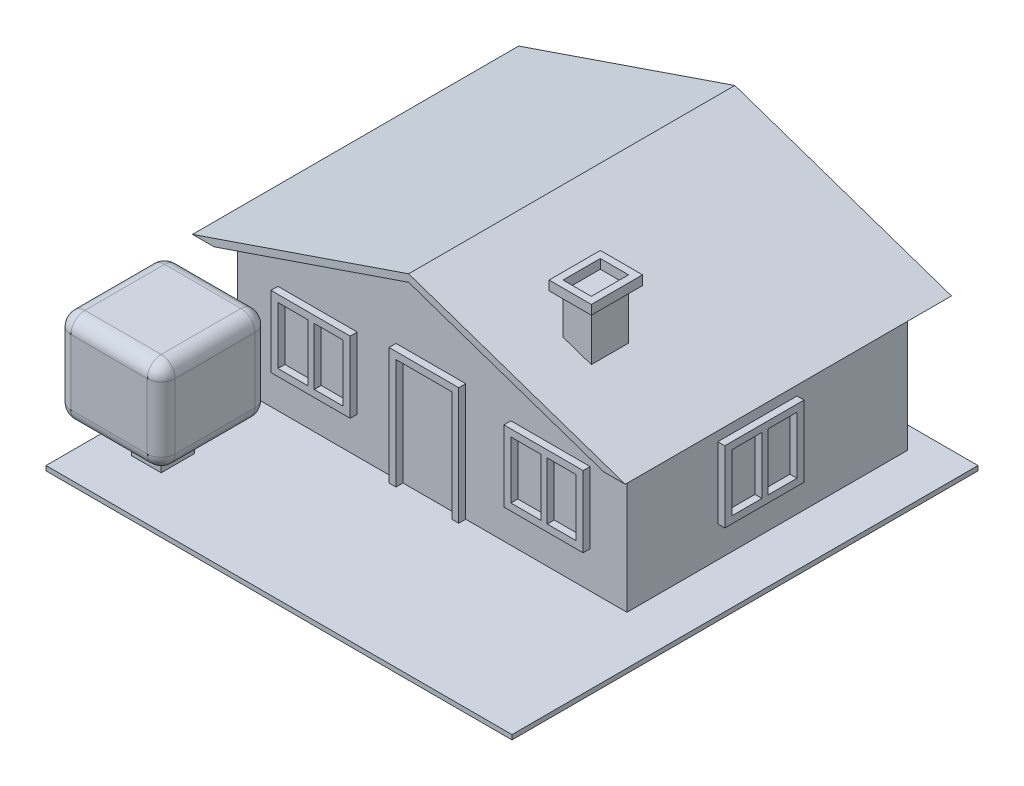
from build123d import *

# Parameters (mm, degrees)
ESBO_O1_W                     = 1
ESBO_O1_H                     = 1
RESSALTO_EXTRUS_O1_DEPTH      = 0.01
ESBO_O2_W                     = 0.835884883
ESBO_O2_H                     = 0.601923969
RESSALTO_EXTRUS_O3_DEPTH      = 0.3
RESSALTO_EXTRUS_O5_DEPTH      = 0.2
RESSALTO_EXTRUS_O5_DEPTH_BACK = 0.5
CORTE_EXTRUS_O2_DEPTH         = 0.050581546
CORTE_EXTRUS_O5_DEPTH         = 0.047494485
ESBO_O8_W                     = 0.17
ESBO_O8_H                     = 0.1527975
ESBO_O8_W_2                   = 0.064789378
ESBO_O8_H_2                   = 0.1227975
ESBO_O8_W_3                   = 0.0620701
RESSALTO_EXTRUS_O7_DEPTH      = 0.015
ESBO_O7_W                     = 0.17
ESBO_O7_H                     = 0.1527975
ESBO_O7_W_2                   = 0.064789378
ESBO_O7_H_2                   = 0.1227975
ESBO_O7_W_3                   = 0.0620701
RESSALTO_EXTRUS_O8_DEPTH      = 0.015
ESBO_O6_W                     = 0.17
ESBO_O6_H                     = 0.152797499
ESBO_O6_W_2                   = 0.0620701
ESBO_O6_H_2                   = 0.122797499
ESBO_O6_W_3                   = 0.064789378
RESSALTO_EXTRUS_O9_DEPTH      = 0.015
ESBO_O9_W                     = 0.063807516
ESBO_O9_H                     = 0.071007721
RESSALTO_EXTRUS_O10_DEPTH     = 0.07
ESBO_O11_W                    = 0.223807516
ESBO_O11_H                    = 0.231007721
RESSALTO_EXTRUS_O11_DEPTH     = 0.2
FILETE2_R                     = 0.03
FILETE3_R                     = 0.03
RESSALTO_EXTRUS_O12_DEPTH     = 0.08
ESBO_O13_W                    = 0.090661603
ESBO_O13_H                    = 0.11
ESBO_O13_W_2                  = 0.060661603
ESBO_O13_H_2                  = 0.08
RESSALTO_EXTRUS_O13_DEPTH     = 0.02


with BuildPart() as part:
    # Esboço1 → Ressalto-extrusão1 (new body)
    with BuildSketch(Plane(origin=(0, 0, 0), x_dir=(1, 0, 0), z_dir=(0, 1, 0))):
        Rectangle(ESBO_O1_W, ESBO_O1_H)
    extrude(amount=RESSALTO_EXTRUS_O1_DEPTH)

    # Esboço2 → Ressalto-extrusão3 (add)
    with BuildSketch(Plane(origin=(0, 0.01, 0), x_dir=(1, 0, 0), z_dir=(0, 1, 0))):
        with Locations((-0.021781552, 0.151543531)):
            Rectangle(ESBO_O2_W, ESBO_O2_H)
    extrude(amount=RESSALTO_EXTRUS_O3_DEPTH)

    # Esboço3 → Ressalto-extrusão5 (add, two sides: drawn at the far end of the back side and taken through both)
    with BuildSketch(Plane.XY.offset(-RESSALTO_EXTRUS_O5_DEPTH_BACK)):
        Polygon((-0.021781553, 0.455456142), (-0.485697767, 0.296752266), (0.443092699, 0.296752266), align=None)
    extrude(amount=RESSALTO_EXTRUS_O5_DEPTH + RESSALTO_EXTRUS_O5_DEPTH_BACK)

    # Esboço4 → Corte-extrusão2 (cut)
    with BuildSketch(Plane.XY.offset(0.2)):
        Polygon((-0.439355675, 0.296752266), (0.396664924, 0.296752266), (-0.021776549, 0.43960441), align=None)
    extrude(amount=-CORTE_EXTRUS_O2_DEPTH, mode=Mode.SUBTRACT)

    # Esboço5 → Corte-extrusão5 (cut)
    with BuildSketch(Plane(origin=(0, 0, -0.5), x_dir=(-1, 0, 0), z_dir=(0, 0, -1))):
        Polygon((0.471154082, 0.285874159), (-0.423424888, 0.287616656), (0.021776549, 0.43960441), align=None)
    extrude(amount=-CORTE_EXTRUS_O5_DEPTH, mode=Mode.SUBTRACT)

    # Esboço8 → Ressalto-extrusão7 (add)
    with BuildSketch(Plane(origin=(0.396160889, 0, 0), x_dir=(0, 0, -1), z_dir=(1, 0, 0))):
        with Locations((0.130456206, 0.153176171)):
            Rectangle(ESBO_O8_W, ESBO_O8_H)
        with Locations((0.092850895, 0.153176171)):
            Rectangle(ESBO_O8_W_2, ESBO_O8_H_2, mode=Mode.SUBTRACT)
        with Locations((0.169421156, 0.153176171)):
            Rectangle(ESBO_O8_W_3, ESBO_O8_H_2, mode=Mode.SUBTRACT)
    extrude(amount=RESSALTO_EXTRUS_O7_DEPTH)

    # Esboço7 → Ressalto-extrusão8 (add)
    with BuildSketch(Plane.ZY.offset(0.439723994)):
        with Locations((-0.158153325, 0.157477131)):
            Rectangle(ESBO_O7_W, ESBO_O7_H)
        with Locations((-0.195758636, 0.157477131)):
            Rectangle(ESBO_O7_W_2, ESBO_O7_H_2, mode=Mode.SUBTRACT)
        with Locations((-0.119188375, 0.157477131)):
            Rectangle(ESBO_O7_W_3, ESBO_O7_H_2, mode=Mode.SUBTRACT)
    extrude(amount=RESSALTO_EXTRUS_O8_DEPTH)

    # Esboço6 → Ressalto-extrusão9 (add)
    # profile 1 of 3: a face of its own
    with BuildSketch(Plane.XY.offset(0.149418454)):
        Polygon((-0.099530915, 0.01), (-0.084530915, 0.01), (-0.084530915, 0.246938695), (0.035135203, 0.246938695), (0.035135203, 0.01), (0.050135203, 0.01), (0.050135203, 0.261938695), (-0.099530915, 0.261938695), align=None)
    # profile 2 of 3: a face of its own
    with BuildSketch(Plane.XY.offset(0.149418454)):
        with Locations((-0.267908896, 0.164969523)):
            Rectangle(ESBO_O6_W, ESBO_O6_H)
        with Locations((-0.228943946, 0.164969523)):
            Rectangle(ESBO_O6_W_2, ESBO_O6_H_2, mode=Mode.SUBTRACT)
        with Locations((-0.305514207, 0.164969523)):
            Rectangle(ESBO_O6_W_3, ESBO_O6_H_2, mode=Mode.SUBTRACT)
    # profile 3 of 3: a face of its own
    with BuildSketch(Plane.XY.offset(0.149418454)):
        with Locations((0.232091104, 0.164969523)):
            Rectangle(ESBO_O6_W, ESBO_O6_H)
        with Locations((0.271056054, 0.164969523)):
            Rectangle(ESBO_O6_W_2, ESBO_O6_H_2, mode=Mode.SUBTRACT)
        with Locations((0.194485793, 0.164969523)):
            Rectangle(ESBO_O6_W_3, ESBO_O6_H_2, mode=Mode.SUBTRACT)
    extrude(amount=RESSALTO_EXTRUS_O9_DEPTH)

    # Esboço9 → Ressalto-extrusão10 (add)
    with BuildSketch(Plane(origin=(0, 0.01, 0), x_dir=(1, 0, 0), z_dir=(0, 1, 0))):
        with Locations((-0.394760136, -0.354413696)):
            Rectangle(ESBO_O9_W, ESBO_O9_H)
    extrude(amount=RESSALTO_EXTRUS_O10_DEPTH)

    # Esboço11 → Ressalto-extrusão11 (add)
    with BuildSketch(Plane(origin=(0, 0.08, 0), x_dir=(1, 0, 0), z_dir=(0, 1, 0))):
        with Locations((-0.394760136, -0.354413696)):
            Rectangle(ESBO_O11_W, ESBO_O11_H)
    extrude(amount=RESSALTO_EXTRUS_O11_DEPTH)

    # Filete2
    filete2_edges = [part.edges().sort_by_distance(p)[0] for p in [
        (-0.506663894, 0.08, 0.354413695),
        (-0.506663894, 0.18, 0.238909835),
        (-0.394760136, 0.08, 0.469917556),
        (-0.506663894, 0.18, 0.469917556),
        (-0.282856378, 0.18, 0.469917556),
        (-0.394760136, 0.28, 0.238909835),
        (-0.506663894, 0.28, 0.354413695),
        (-0.394760136, 0.28, 0.469917556),
        (-0.282856378, 0.28, 0.354413695),
    ]]
    fillet(filete2_edges, radius=FILETE2_R)

    # Filete3
    # the kernel refuses this fillet: 0.03 mm, written as the material it takes off along each edge
    with BuildSketch(Plane(origin=(-0.476663894, 0.11, 0.268909835), x_dir=(0, 0, -1), z_dir=(0, -1, 0))) as filete3_piece_1_section:
        Polygon((0, 0), (FILETE3_R, 0), (FILETE3_R, -FILETE3_R), (0, -FILETE3_R), align=None)
    filete3_piece_1 = extrude(amount=FILETE3_R, mode=Mode.PRIVATE)
    filete3_piece_1 = filete3_piece_1 - Plane(origin=(-0.476663894, 0.11, 0.268909835), x_dir=(0.7071067811865475, 0, 0.7071067811865475), z_dir=(0, -1, 0)) * Sphere(FILETE3_R, mode=Mode.PRIVATE)
    add(filete3_piece_1, mode=Mode.SUBTRACT)
    with BuildSketch(Plane(origin=(-0.312856378, 0.25, 0.268909835), x_dir=(1, 0, 0), z_dir=(0, 0, -1))) as filete3_piece_2_section:
        Polygon((0, 0), (FILETE3_R, 0), (FILETE3_R, -FILETE3_R), (0, -FILETE3_R), align=None)
    filete3_piece_2 = extrude(amount=FILETE3_R, mode=Mode.PRIVATE)
    filete3_piece_2 = filete3_piece_2 - Plane(origin=(-0.312856378, 0.25, 0.268909835), x_dir=(-0.7071067811865475, -0.7071067811865475, 0), z_dir=(0, 0, -1)) * Sphere(FILETE3_R, mode=Mode.PRIVATE)
    add(filete3_piece_2, mode=Mode.SUBTRACT)
    with BuildSketch(Plane(origin=(-0.312856378, 0.11, 0.439917556), x_dir=(1, 0, 0), z_dir=(0, -1, 0))) as filete3_piece_3_section:
        Polygon((0, 0), (FILETE3_R, 0), (FILETE3_R, FILETE3_R), (0, FILETE3_R), align=None)
    filete3_piece_3 = extrude(amount=FILETE3_R, mode=Mode.PRIVATE)
    filete3_piece_3 = filete3_piece_3 - Plane(origin=(-0.312856378, 0.11, 0.439917556), x_dir=(-0.7071067811865475, 0, -0.7071067811865475), z_dir=(0, -1, 0)) * Sphere(FILETE3_R, mode=Mode.PRIVATE)
    add(filete3_piece_3, mode=Mode.SUBTRACT)
    with BuildSketch(Plane(origin=(-0.312856378, 0.11, 0.268909835), x_dir=(0, -1, 0), z_dir=(1, 0, 0))) as filete3_piece_4_section:
        Polygon((0, 0), (FILETE3_R, 0), (FILETE3_R, FILETE3_R), (0, FILETE3_R), align=None)
    filete3_piece_4 = extrude(amount=FILETE3_R, mode=Mode.PRIVATE)
    filete3_piece_4 = filete3_piece_4 - Plane(origin=(-0.312856378, 0.11, 0.268909835), x_dir=(0, 0.7071067811865475, 0.7071067811865475), z_dir=(1, 0, 0)) * Sphere(FILETE3_R, mode=Mode.PRIVATE)
    add(filete3_piece_4, mode=Mode.SUBTRACT)
    with BuildSketch(Plane(origin=(-0.312856378, 0.08, 0.238909835), x_dir=(0, 0, 1), z_dir=(-1, 0, 0))) as filete3_piece_5:
        with BuildLine():
            CenterArc((FILETE3_R, FILETE3_R), FILETE3_R, 180, 90)
            Line((0, FILETE3_R), (0, 0))
            Line((0, 0), (FILETE3_R, 0))
        make_face()
    extrude(amount=0.163807516, mode=Mode.SUBTRACT)
    with BuildSketch(Plane(origin=(-0.282856378, 0.08, 0.439917556), x_dir=(-1, 0, 0), z_dir=(0, 0, -1))) as filete3_piece_6:
        with BuildLine():
            CenterArc((FILETE3_R, FILETE3_R), FILETE3_R, 180, 90)
            Line((0, FILETE3_R), (0, 0))
            Line((0, 0), (FILETE3_R, 0))
        make_face()
    extrude(amount=0.171007722, mode=Mode.SUBTRACT)
    with BuildSketch(Plane(origin=(-0.282856378, 0.11, 0.238909835), x_dir=(-1, 0, 0), z_dir=(0, 1, 0))) as filete3_piece_7:
        with BuildLine():
            CenterArc((FILETE3_R, FILETE3_R), FILETE3_R, 180, 90)
            Line((0, FILETE3_R), (0, 0))
            Line((0, 0), (FILETE3_R, 0))
        make_face()
    extrude(amount=0.14, mode=Mode.SUBTRACT)

    # Esboço12 → Ressalto-extrusão12 (add)
    with BuildSketch(Plane.XY):
        Polygon((0.189525463, 0.383317833), (0.250187066, 0.362608509), (0.250187066, 0.469514712), (0.189525463, 0.469514712), align=None)
    extrude(amount=RESSALTO_EXTRUS_O12_DEPTH)


with BuildPart() as body_2:
    # Esboço13 → Ressalto-extrusão13 (new body)
    with BuildSketch(Plane(origin=(0, 0.469514712, 0), x_dir=(1, 0, 0), z_dir=(0, 1, 0))):
        with Locations((0.219856265, -0.04)):
            Rectangle(ESBO_O13_W, ESBO_O13_H)
        with Locations((0.219856265, -0.04)):
            Rectangle(ESBO_O13_W_2, ESBO_O13_H_2, mode=Mode.SUBTRACT)
    extrude(amount=RESSALTO_EXTRUS_O13_DEPTH)


solid = Compound([part.part, body_2.part])
